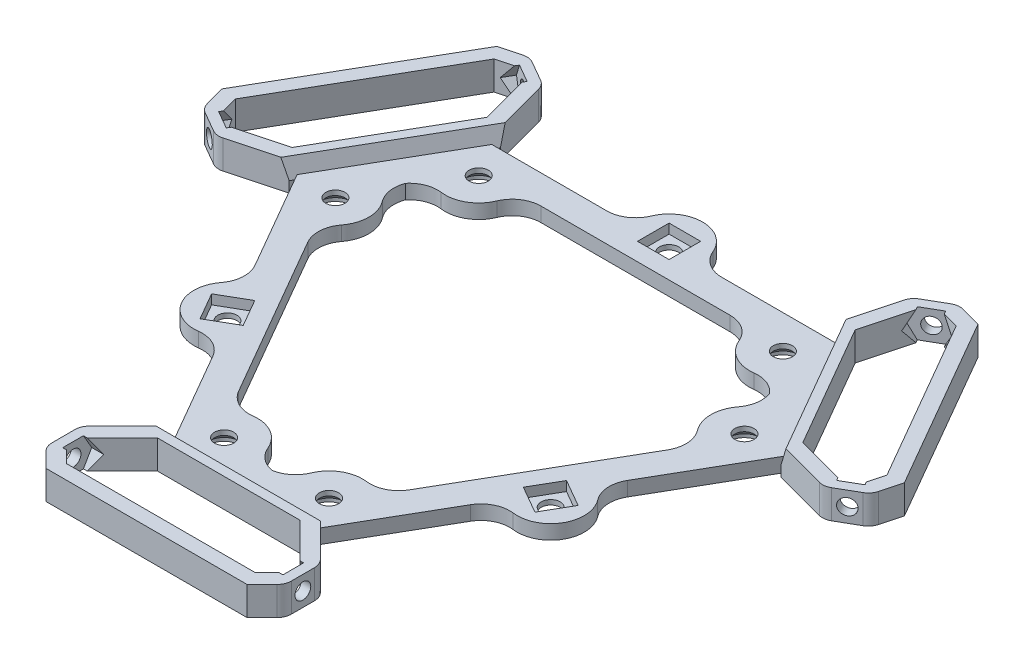
from build123d import *

# Parameters (mm, degrees)
BOSS_EXTRUDE1_DEPTH     = 3
BOSS_EXTRUDE2_DEPTH     = 6
SKETCH3_R               = 1.65
CUT_EXTRUDE1_DEPTH      = 104.454603872
CUT_EXTRUDE2_DEPTH      = 45.757359
CUT_EXTRUDE2_DEPTH_BACK = 0.242641
CIRPATTERN2_COUNT       = 3
CUT_EXTRUDE4_DEPTH      = 45.757359
CUT_EXTRUDE4_DEPTH_BACK = 0.242641
CUT_EXTRUDE5_DEPTH      = 45.757359
CUT_EXTRUDE5_DEPTH_BACK = 0.242641
SKETCH5_R               = 2
CUT_EXTRUDE3_DEPTH      = 101.034117673
CHAMFER1_SIZE           = 3.732050808
CHAMFER1_SIZE_2         = 1
FILLET2_R               = 3
SKETCH8_R               = 3.3
CUT_EXTRUDE6_DEPTH      = 2
CHAMFER2_SIZE           = 1.3
SKETCH9_R               = 7
BOSS_EXTRUDE3_DEPTH     = 3
SKETCH10_W              = 6.6
SKETCH10_H              = 6.6
CUT_EXTRUDE7_DEPTH      = 2
SKETCH11_R              = 2
CUT_EXTRUDE8_DEPTH      = 101.034117673
FILLET1_R               = 6


# Some blends are built 0.0001 mm under size
with BuildPart() as part:
    # Sketch1 → Boss-Extrude1 (new body)
    with BuildSketch(Plane(origin=(0, 0, 0), x_dir=(1, 0, 0), z_dir=(0, 1, 0))):
        Polygon((50.801270189, 12.009618943), (35.801270189, 37.990381057), (-35.801270189, 37.990381057), (-50.801270189, 12.009618943), (-15, -50), (15, -50), align=None)
        with BuildLine():
            Line((-40.120290209, 18.509618943), (-36.089945324, 25.490381057))
            ThreePointArc((-36.089945324, 25.490381057), (-28.259818305, 24.92820323), (-24.831615075, 31.990381057))
            Line((-24.831615075, 31.990381057), (24.831615075, 31.990381057))
            ThreePointArc((24.831615075, 31.990381057), (28.259818305, 24.92820323), (36.089945324, 25.490381057))
            Line((36.089945324, 25.490381057), (40.120290209, 18.509618943))
            ThreePointArc((40.120290209, 18.509618943), (35.718366421, 12.009618943), (40.120290209, 5.509618943))
            Line((40.120290209, 5.509618943), (15.288675135, -37.5))
            ThreePointArc((15.288675135, -37.5), (7.458548116, -36.937822174), (4.030344885, -44))
            Line((4.030344885, -44), (-4.030344885, -44))
            ThreePointArc((-4.030344885, -44), (-7.458548116, -36.937822174), (-15.288675135, -37.5))
            Line((-15.288675135, -37.5), (-40.120290209, 5.509618943))
            ThreePointArc((-40.120290209, 5.509618943), (-35.718366421, 12.009618943), (-40.120290209, 18.509618943))
        make_face(mode=Mode.SUBTRACT)
    extrude(amount=BOSS_EXTRUDE1_DEPTH)

    # Sketch2 → Boss-Extrude2 (add)
    with BuildSketch(Plane.XZ):
        Polygon((25, 60.85), (25, 58.85), (16.15, 50), (-16.15, 50), (-25, 58.85), (-25, 60.85), (-25, 64.15), (-25, 66.15), (-21, 70.15), (21, 70.15), (25, 66.15), (25, 64.15), align=None)
        Polygon((-14.907359313, 53), (14.907359313, 53), (22.757359313, 60.85), (22.757359313, 64.15), (19.757359313, 67.15), (-19.757359313, 67.15), (-22.757359313, 64.15), (-22.757359313, 60.85), align=None, mode=Mode.SUBTRACT)
    boss_extrude2 = extrude(amount=-BOSS_EXTRUDE2_DEPTH)

    # Sketch3 → Cut-Extrude1 (cut, through all)
    with BuildSketch(Plane(origin=(25, 0, 0), x_dir=(0, 0, -1), z_dir=(1, 0, 0))):
        with Locations(Location((-62.5, 3, 0), (0, 0, 180))):
            Circle(SKETCH3_R)
    cut_extrude1 = extrude(amount=-CUT_EXTRUDE1_DEPTH, mode=Mode.SUBTRACT)

    # Sketch4 → Cut-Extrude2 (cut, two sides: drawn at the far end of the back side and taken through both)
    with BuildSketch(Plane(origin=(-22.757359313, 0, 0), x_dir=(0, 0, -1), z_dir=(1, 0, 0)).offset(-CUT_EXTRUDE2_DEPTH_BACK)):
        Polygon((-58.602885683, 3), (-60.551442841, 6.375), (-64.448557159, 6.375), (-66.397114317, 3), (-64.448557159, -0.375), (-60.551442841, -0.375), align=None)
    extrude(amount=CUT_EXTRUDE2_DEPTH + CUT_EXTRUDE2_DEPTH_BACK, mode=Mode.SUBTRACT)

    # CirPattern2: Boss-Extrude2, Cut-Extrude1 ×3 about axis
    cirpattern2_axis = Axis((0, 0, 0), (0, 1, 0))
    add([boss_extrude2.rotate(cirpattern2_axis, i * 360 / CIRPATTERN2_COUNT) for i in range(1, CIRPATTERN2_COUNT)])
    add([cut_extrude1.rotate(cirpattern2_axis, i * 360 / CIRPATTERN2_COUNT) for i in range(1, CIRPATTERN2_COUNT)], mode=Mode.SUBTRACT)

    # Sketch6 → Cut-Extrude4 (cut, two sides: drawn at the far end of the back side and taken through both)
    with BuildSketch(Plane(origin=(-11.378679656, 0, -19.708451288), x_dir=(0.8660254037844433, 0, -0.4999999999999921), z_dir=(0.49999999999999206, 0, 0.8660254037844431)).offset(-CUT_EXTRUDE4_DEPTH_BACK)):
        Polygon((58.602885683, 3), (60.551442841, -0.375), (64.448557159, -0.375), (66.397114317, 3), (64.448557159, 6.375), (60.551442841, 6.375), align=None)
    extrude(amount=CUT_EXTRUDE4_DEPTH + CUT_EXTRUDE4_DEPTH_BACK, mode=Mode.SUBTRACT)

    # Sketch7 → Cut-Extrude5 (cut, two sides: drawn at the far end of the back side and taken through both)
    with BuildSketch(Plane(origin=(-11.378679656, 0, 19.708451288), x_dir=(-0.8660254037844364, 0, -0.500000000000004), z_dir=(0.500000000000004, 0, -0.8660254037844365)).offset(-CUT_EXTRUDE5_DEPTH_BACK)):
        Polygon((58.602885683, 3), (60.551442841, -0.375), (64.448557159, -0.375), (66.397114317, 3), (64.448557159, 6.375), (60.551442841, 6.375), align=None)
    extrude(amount=CUT_EXTRUDE5_DEPTH + CUT_EXTRUDE5_DEPTH_BACK, mode=Mode.SUBTRACT)

    # Sketch5 → Cut-Extrude3 (cut, through all)
    with BuildSketch(Plane(origin=(0, 3, 0), x_dir=(1, 0, 0), z_dir=(0, 1, 0))):
        with Locations(Location((42.718366421, 12.009618943, 0), (0, 0, 270))):
            Circle(SKETCH5_R)
        with Locations(Location((31.759818305, 30.990381057, 0), (0, 0, 270))):
            Circle(SKETCH5_R)
        with Locations(Location((10.958548116, -43, 0), (0, 0, 270))):
            Circle(SKETCH5_R)
        with Locations(Location((-10.958548116, -43, 0), (0, 0, 270))):
            Circle(SKETCH5_R)
        with Locations(Location((-42.718366421, 12.009618943, 0), (0, 0, 270))):
            Circle(SKETCH5_R)
        with Locations(Location((-31.759818305, 30.990381057, 0), (0, 0, 270))):
            Circle(SKETCH5_R)
    extrude(amount=-CUT_EXTRUDE3_DEPTH, mode=Mode.SUBTRACT)

    # Chamfer1
    # the kernel refuses this chamfer: 3.732050808, 1 mm, written as the material it takes off along each edge
    with BuildSketch(Plane(origin=(30.380721773, 6, -47.379046319), x_dir=(-0.00863180213905993, -0.9999503267608393, 0.004983573288577835), z_dir=(0.49999999999999983, 0, 0.8660254037844388))) as chamfer1_piece_1_section:
        Polygon((CHAMFER1_SIZE * 0.999950326645, CHAMFER1_SIZE * 0.009967146576), (-CHAMFER1_SIZE_2 * 0.00996714657716, CHAMFER1_SIZE_2 * 0.999950326761), (0, 0), align=None)
    chamfer1_piece_1 = extrude(amount=51.682193666, mode=Mode.PRIVATE)
    chamfer1_piece_1 = split(chamfer1_piece_1, bisect_by=Plane(origin=(33.0925321, 2.648418208, -37.990381057), z_dir=(0, 0, -1)), keep=Keep.TOP, mode=Mode.PRIVATE)
    chamfer1_piece_1 = split(chamfer1_piece_1, bisect_by=Plane(origin=(33.0925321, 3, -42.685093779), z_dir=(0, -1, 0)), keep=Keep.TOP, mode=Mode.PRIVATE)
    add(chamfer1_piece_1, mode=Mode.SUBTRACT)
    with BuildSketch(Plane(origin=(30.380721773, 6, -47.379046319), x_dir=(-0.00863180213905993, -0.9999503267608393, 0.004983573288577835), z_dir=(0.49999999999999983, 0, 0.8660254037844388))) as chamfer1_piece_2_section:
        Polygon((CHAMFER1_SIZE * 0.999950326645, CHAMFER1_SIZE * 0.009967146576), (-CHAMFER1_SIZE_2 * 0.00996714657716, CHAMFER1_SIZE_2 * 0.999950326761), (0, 0), align=None)
    chamfer1_piece_2 = extrude(amount=51.682193666, mode=Mode.PRIVATE)
    chamfer1_piece_2 = split(chamfer1_piece_2, bisect_by=Plane(origin=(33.414534545, 4.859018741, -37.990381057), z_dir=(0, 0, -1)), keep=Keep.TOP, mode=Mode.PRIVATE)
    chamfer1_piece_2 = split(chamfer1_piece_2, bisect_by=Plane(origin=(33.414534545, 3, -42.764768721), z_dir=(0, 1, 0)), keep=Keep.TOP, mode=Mode.PRIVATE)
    add(chamfer1_piece_2, mode=Mode.SUBTRACT)
    with BuildSketch(Plane(origin=(30.380721773, 6, -47.379046319), x_dir=(-0.00863180213905993, -0.9999503267608393, 0.004983573288577835), z_dir=(0.49999999999999983, 0, 0.8660254037844388))) as chamfer1_piece_3_section:
        Polygon((CHAMFER1_SIZE * 0.999950326645, CHAMFER1_SIZE * 0.009967146576), (-CHAMFER1_SIZE_2 * 0.00996714657716, CHAMFER1_SIZE_2 * 0.999950326761), (0, 0), align=None)
    chamfer1_piece_3 = extrude(amount=51.682193666, mode=Mode.PRIVATE)
    chamfer1_piece_3 = split(chamfer1_piece_3, bisect_by=Plane(origin=(43.573101268, 4.849417348, -37.990381057), z_dir=(0, 0, 1)), keep=Keep.TOP, mode=Mode.PRIVATE)
    chamfer1_piece_3 = split(chamfer1_piece_3, bisect_by=Plane(origin=(43.573101268, 3, -25.156941746), z_dir=(0, 1, 0)), keep=Keep.TOP, mode=Mode.PRIVATE)
    chamfer1_piece_3 = split(chamfer1_piece_3, bisect_by=Plane(origin=(54.687185728, 4.849417348, -18.740222091), z_dir=(-0.8660254037844388, 0, -0.4999999999999998)), keep=Keep.TOP, mode=Mode.PRIVATE)
    add(chamfer1_piece_3, mode=Mode.SUBTRACT)
    with BuildSketch(Plane(origin=(30.380721773, 6, -47.379046319), x_dir=(-0.00863180213905993, -0.9999503267608393, 0.004983573288577835), z_dir=(0.49999999999999983, 0, 0.8660254037844388))) as chamfer1_piece_4_section:
        Polygon((CHAMFER1_SIZE * 0.999950326645, CHAMFER1_SIZE * 0.009967146576), (-CHAMFER1_SIZE_2 * 0.00996714657716, CHAMFER1_SIZE_2 * 0.999950326761), (0, 0), align=None)
    chamfer1_piece_4 = extrude(amount=51.682193666, mode=Mode.PRIVATE)
    chamfer1_piece_4 = split(chamfer1_piece_4, bisect_by=Plane(origin=(53.512641626, 3, -7.316426585), z_dir=(0, -1, 0)), keep=Keep.TOP, mode=Mode.PRIVATE)
    chamfer1_piece_4 = split(chamfer1_piece_4, bisect_by=Plane(origin=(49.446901145, 2.648418208, -9.663782946), z_dir=(0.8660254037844388, 0, 0.4999999999999998)), keep=Keep.TOP, mode=Mode.PRIVATE)
    add(chamfer1_piece_4, mode=Mode.SUBTRACT)
    with BuildSketch(Plane(origin=(30.380721773, 6, -47.379046319), x_dir=(-0.00863180213905993, -0.9999503267608393, 0.004983573288577835), z_dir=(0.49999999999999983, 0, 0.8660254037844388))) as chamfer1_piece_5_section:
        Polygon((CHAMFER1_SIZE * 0.999950326645, CHAMFER1_SIZE * 0.009967146576), (-CHAMFER1_SIZE_2 * 0.00996714657716, CHAMFER1_SIZE_2 * 0.999950326761), (0, 0), align=None)
    chamfer1_piece_5 = extrude(amount=51.682193666, mode=Mode.PRIVATE)
    chamfer1_piece_5 = split(chamfer1_piece_5, bisect_by=Plane(origin=(53.742643372, 3, -7.555451411), z_dir=(0, 1, 0)), keep=Keep.TOP, mode=Mode.PRIVATE)
    chamfer1_piece_5 = split(chamfer1_piece_5, bisect_by=Plane(origin=(49.607902367, 4.859018741, -9.942645243), z_dir=(0.8660254037844388, 0, 0.4999999999999998)), keep=Keep.TOP, mode=Mode.PRIVATE)
    add(chamfer1_piece_5, mode=Mode.SUBTRACT)
    with BuildSketch(Plane(origin=(25.841096833, 6, 50), x_dir=(0, -0.9999503267608393, -0.00996714657715677), z_dir=(-1, 0, 0))) as chamfer1_piece_6_section:
        Polygon((CHAMFER1_SIZE * 0.999950326645, CHAMFER1_SIZE * 0.00996714657601), (-CHAMFER1_SIZE_2 * 0.00996714657716, CHAMFER1_SIZE_2 * 0.999950326761), (0, 0), align=None)
    chamfer1_piece_6 = extrude(amount=51.682193666, mode=Mode.PRIVATE)
    chamfer1_piece_6 = split(chamfer1_piece_6, bisect_by=Plane(origin=(16.354369044, 2.648418208, 47.654164003), z_dir=(0.8660254037844388, 0, 0.4999999999999998)), keep=Keep.TOP, mode=Mode.PRIVATE)
    chamfer1_piece_6 = split(chamfer1_piece_6, bisect_by=Plane(origin=(20.420109525, 3, 50.001520364), z_dir=(0, -1, 0)), keep=Keep.TOP, mode=Mode.PRIVATE)
    add(chamfer1_piece_6, mode=Mode.SUBTRACT)
    with BuildSketch(Plane(origin=(25.841096833, 6, 50), x_dir=(0, -0.9999503267608393, -0.00996714657715677), z_dir=(-1, 0, 0))) as chamfer1_piece_7_section:
        Polygon((CHAMFER1_SIZE * 0.999950326645, CHAMFER1_SIZE * 0.00996714657601), (-CHAMFER1_SIZE_2 * 0.00996714657716, CHAMFER1_SIZE_2 * 0.999950326761), (0, 0), align=None)
    chamfer1_piece_7 = extrude(amount=51.682193666, mode=Mode.PRIVATE)
    chamfer1_piece_7 = split(chamfer1_piece_7, bisect_by=Plane(origin=(16.193367822, 4.859018741, 47.9330263), z_dir=(0.8660254037844388, 0, 0.4999999999999998)), keep=Keep.TOP, mode=Mode.PRIVATE)
    chamfer1_piece_7 = split(chamfer1_piece_7, bisect_by=Plane(origin=(20.328108827, 3, 50.320220132), z_dir=(0, 1, 0)), keep=Keep.TOP, mode=Mode.PRIVATE)
    add(chamfer1_piece_7, mode=Mode.SUBTRACT)
    with BuildSketch(Plane(origin=(25.841096833, 6, 50), x_dir=(0, -0.9999503267608393, -0.00996714657715677), z_dir=(-1, 0, 0))) as chamfer1_piece_8_section:
        Polygon((CHAMFER1_SIZE * 0.999950326645, CHAMFER1_SIZE * 0.00996714657601), (-CHAMFER1_SIZE_2 * 0.00996714657716, CHAMFER1_SIZE_2 * 0.999950326761), (0, 0), align=None)
    chamfer1_piece_8 = extrude(amount=51.682193666, mode=Mode.PRIVATE)
    chamfer1_piece_8 = split(chamfer1_piece_8, bisect_by=Plane(origin=(-11.114084461, 4.849417348, 56.730603148), z_dir=(0.866025403784439, 0, -0.49999999999999944)), keep=Keep.TOP, mode=Mode.PRIVATE)
    chamfer1_piece_8 = split(chamfer1_piece_8, bisect_by=Plane(origin=(11.114084461, 4.849417348, 56.730603148), z_dir=(-0.8660254037844388, 0, -0.4999999999999998)), keep=Keep.TOP, mode=Mode.PRIVATE)
    chamfer1_piece_8 = split(chamfer1_piece_8, bisect_by=Plane(origin=(0, 3, 50.313883493), z_dir=(0, 1, 0)), keep=Keep.TOP, mode=Mode.PRIVATE)
    add(chamfer1_piece_8, mode=Mode.SUBTRACT)
    with BuildSketch(Plane(origin=(25.841096833, 6, 50), x_dir=(0, -0.9999503267608393, -0.00996714657715677), z_dir=(-1, 0, 0))) as chamfer1_piece_9_section:
        Polygon((CHAMFER1_SIZE * 0.999950326645, CHAMFER1_SIZE * 0.00996714657601), (-CHAMFER1_SIZE_2 * 0.00996714657716, CHAMFER1_SIZE_2 * 0.999950326761), (0, 0), align=None)
    chamfer1_piece_9 = extrude(amount=51.682193666, mode=Mode.PRIVATE)
    chamfer1_piece_9 = split(chamfer1_piece_9, bisect_by=Plane(origin=(-16.354369044, 2.648418208, 47.654164003), z_dir=(-0.866025403784439, 0, 0.49999999999999944)), keep=Keep.TOP, mode=Mode.PRIVATE)
    chamfer1_piece_9 = split(chamfer1_piece_9, bisect_by=Plane(origin=(-20.420109525, 3, 50.001520364), z_dir=(0, -1, 0)), keep=Keep.TOP, mode=Mode.PRIVATE)
    add(chamfer1_piece_9, mode=Mode.SUBTRACT)
    with BuildSketch(Plane(origin=(25.841096833, 6, 50), x_dir=(0, -0.9999503267608393, -0.00996714657715677), z_dir=(-1, 0, 0))) as chamfer1_piece_10_section:
        Polygon((CHAMFER1_SIZE * 0.999950326645, CHAMFER1_SIZE * 0.00996714657601), (-CHAMFER1_SIZE_2 * 0.00996714657716, CHAMFER1_SIZE_2 * 0.999950326761), (0, 0), align=None)
    chamfer1_piece_10 = extrude(amount=51.682193666, mode=Mode.PRIVATE)
    chamfer1_piece_10 = split(chamfer1_piece_10, bisect_by=Plane(origin=(-16.193367822, 4.859018741, 47.9330263), z_dir=(-0.866025403784439, 0, 0.49999999999999944)), keep=Keep.TOP, mode=Mode.PRIVATE)
    chamfer1_piece_10 = split(chamfer1_piece_10, bisect_by=Plane(origin=(-20.328108827, 3, 50.320220132), z_dir=(0, 1, 0)), keep=Keep.TOP, mode=Mode.PRIVATE)
    add(chamfer1_piece_10, mode=Mode.SUBTRACT)
    with BuildSketch(Plane(origin=(-56.221818606, 6, -2.620953681), x_dir=(-0.8577981960727488, 0.1375124470212913, -0.49525001941297747), z_dir=(0.5000000000000004, 0, -0.8660254037844384))) as chamfer1_piece_11_section:
        Polygon((CHAMFER1_SIZE_2 * 0.990500038826, -CHAMFER1_SIZE_2 * 0.137512447021), (-CHAMFER1_SIZE * 0.137512447005, -CHAMFER1_SIZE * 0.990500038712), (0, 0), align=None)
    chamfer1_piece_11 = extrude(amount=51.682193666, mode=Mode.PRIVATE)
    chamfer1_piece_11 = split(chamfer1_piece_11, bisect_by=Plane(origin=(-49.607902367, 4.859018741, -9.942645243), z_dir=(-0.866025403784439, 0, 0.49999999999999944)), keep=Keep.TOP, mode=Mode.PRIVATE)
    chamfer1_piece_11 = split(chamfer1_piece_11, bisect_by=Plane(origin=(-53.742643372, 3, -7.555451411), z_dir=(0, 1, 0)), keep=Keep.TOP, mode=Mode.PRIVATE)
    add(chamfer1_piece_11, mode=Mode.SUBTRACT)
    with BuildSketch(Plane(origin=(-56.221818606, 6, -2.620953681), x_dir=(-0.8577981960727488, 0.1375124470212913, -0.49525001941297747), z_dir=(0.5000000000000004, 0, -0.8660254037844384))) as chamfer1_piece_12_section:
        Polygon((CHAMFER1_SIZE_2 * 0.990500038826, -CHAMFER1_SIZE_2 * 0.137512447021), (-CHAMFER1_SIZE * 0.137512447005, -CHAMFER1_SIZE * 0.990500038712), (0, 0), align=None)
    chamfer1_piece_12 = extrude(amount=51.682193666, mode=Mode.PRIVATE)
    chamfer1_piece_12 = split(chamfer1_piece_12, bisect_by=Plane(origin=(-49.446901145, 2.648418208, -9.663782946), z_dir=(-0.866025403784439, 0, 0.49999999999999944)), keep=Keep.TOP, mode=Mode.PRIVATE)
    chamfer1_piece_12 = split(chamfer1_piece_12, bisect_by=Plane(origin=(-53.512641626, 3, -7.316426585), z_dir=(0, -1, 0)), keep=Keep.TOP, mode=Mode.PRIVATE)
    add(chamfer1_piece_12, mode=Mode.SUBTRACT)
    with BuildSketch(Plane(origin=(-56.221818606, 6, -2.620953681), x_dir=(-0.8577981960727488, 0.1375124470212913, -0.49525001941297747), z_dir=(0.5000000000000004, 0, -0.8660254037844384))) as chamfer1_piece_13_section:
        Polygon((CHAMFER1_SIZE_2 * 0.990500038826, -CHAMFER1_SIZE_2 * 0.137512447021), (-CHAMFER1_SIZE * 0.137512447005, -CHAMFER1_SIZE * 0.990500038712), (0, 0), align=None)
    chamfer1_piece_13 = extrude(amount=51.682193666, mode=Mode.PRIVATE)
    chamfer1_piece_13 = split(chamfer1_piece_13, bisect_by=Plane(origin=(-54.687185728, 4.849417348, -18.740222091), z_dir=(0.866025403784439, 0, -0.49999999999999944)), keep=Keep.TOP, mode=Mode.PRIVATE)
    chamfer1_piece_13 = split(chamfer1_piece_13, bisect_by=Plane(origin=(-43.573101268, 3, -25.156941746), z_dir=(0, 1, 0)), keep=Keep.TOP, mode=Mode.PRIVATE)
    chamfer1_piece_13 = split(chamfer1_piece_13, bisect_by=Plane(origin=(-43.573101268, 4.849417348, -37.990381057), z_dir=(0, 0, 1)), keep=Keep.TOP, mode=Mode.PRIVATE)
    add(chamfer1_piece_13, mode=Mode.SUBTRACT)
    with BuildSketch(Plane(origin=(-56.221818606, 6, -2.620953681), x_dir=(-0.8577981960727488, 0.1375124470212913, -0.49525001941297747), z_dir=(0.5000000000000004, 0, -0.8660254037844384))) as chamfer1_piece_14_section:
        Polygon((CHAMFER1_SIZE_2 * 0.990500038826, -CHAMFER1_SIZE_2 * 0.137512447021), (-CHAMFER1_SIZE * 0.137512447005, -CHAMFER1_SIZE * 0.990500038712), (0, 0), align=None)
    chamfer1_piece_14 = extrude(amount=51.682193666, mode=Mode.PRIVATE)
    chamfer1_piece_14 = split(chamfer1_piece_14, bisect_by=Plane(origin=(-33.414534545, 3, -42.764768721), z_dir=(0, 1, 0)), keep=Keep.TOP, mode=Mode.PRIVATE)
    chamfer1_piece_14 = split(chamfer1_piece_14, bisect_by=Plane(origin=(-33.414534545, 4.859018741, -37.990381057), z_dir=(0, 0, -1)), keep=Keep.TOP, mode=Mode.PRIVATE)
    add(chamfer1_piece_14, mode=Mode.SUBTRACT)
    with BuildSketch(Plane(origin=(-56.221818606, 6, -2.620953681), x_dir=(-0.8577981960727488, 0.1375124470212913, -0.49525001941297747), z_dir=(0.5000000000000004, 0, -0.8660254037844384))) as chamfer1_piece_15_section:
        Polygon((CHAMFER1_SIZE_2 * 0.990500038826, -CHAMFER1_SIZE_2 * 0.137512447021), (-CHAMFER1_SIZE * 0.137512447005, -CHAMFER1_SIZE * 0.990500038712), (0, 0), align=None)
    chamfer1_piece_15 = extrude(amount=51.682193666, mode=Mode.PRIVATE)
    chamfer1_piece_15 = split(chamfer1_piece_15, bisect_by=Plane(origin=(-33.0925321, 3, -42.685093779), z_dir=(0, -1, 0)), keep=Keep.TOP, mode=Mode.PRIVATE)
    chamfer1_piece_15 = split(chamfer1_piece_15, bisect_by=Plane(origin=(-33.0925321, 2.648418208, -37.990381057), z_dir=(0, 0, -1)), keep=Keep.TOP, mode=Mode.PRIVATE)
    add(chamfer1_piece_15, mode=Mode.SUBTRACT)

    # Fillet2
    fillet2_edges = [part.edges().sort_by_distance(p)[0] for p in [
        (-69.78758046, 3, -11.424364905),
        (-63.465595013, 3, -7.774364905),
        (-38.465595013, 3, -51.075635095),
        (-44.78758046, 3, -54.725635095),
        (44.78758046, 3, -54.725635095),
        (38.465595013, 3, -51.075635095),
        (63.465595013, 3, -7.774364905),
        (69.78758046, 3, -11.424364905),
        (25, 3, 66.15),
        (25, 3, 58.85),
        (-25, 3, 58.85),
        (-25, 3, 66.15),
    ]]
    fillet(fillet2_edges, radius=FILLET2_R)

    # Sketch8 → Cut-Extrude6 (cut)
    with BuildSketch(Plane.XZ):
        with Locations(Location((31.759818305, -30.990381057, 0), (0, 0, 270))):
            Circle(SKETCH8_R)
        with Locations(Location((42.718366421, -12.009618943, 0), (0, 0, 270))):
            Circle(SKETCH8_R)
        with Locations(Location((10.958548116, 43, 0), (0, 0, 270))):
            Circle(SKETCH8_R)
        with Locations(Location((-10.958548116, 43, 0), (0, 0, 270))):
            Circle(SKETCH8_R)
        with Locations(Location((-42.718366421, -12.009618943, 0), (0, 0, 270))):
            Circle(SKETCH8_R)
        with Locations(Location((-31.759818305, -30.990381057, 0), (0, 0, 270))):
            Circle(SKETCH8_R)
    extrude(amount=-CUT_EXTRUDE6_DEPTH, mode=Mode.SUBTRACT)

    # Chamfer2
    chamfer2_edges = [part.edges().sort_by_distance(p)[0] for p in [
        (31.759818305, 2, -27.690381057),
        (42.718366421, 2, -8.709618943),
        (10.958548116, 2, 46.3),
        (-10.958548116, 2, 46.3),
        (-42.718366421, 2, -8.709618943),
        (-31.759818305, 2, -27.690381057),
    ]]
    chamfer(chamfer2_edges, length=CHAMFER2_SIZE - 0.0001)  # a hair under: the kernel refuses the full size

    # Sketch9 → Boss-Extrude3 (add)
    with BuildSketch(Plane.XZ):
        with Locations((-33.766660498, 19.495190528)):
            Circle(SKETCH9_R)
        with Locations((33.766660498, 19.495190528)):
            Circle(SKETCH9_R)
        with Locations((0, -38.990381057)):
            Circle(SKETCH9_R)
    extrude(amount=-BOSS_EXTRUDE3_DEPTH)

    # Sketch10 → Cut-Extrude7 (cut)
    with BuildSketch(Plane(origin=(0, 3, 0), x_dir=(1, 0, 0), z_dir=(0, 1, 0))):
        Polygon((32.558776666, -14.987306696), (29.258776666, -20.703074361), (34.974544331, -24.003074361), (38.274544331, -18.287306696), align=None)
        with Locations((0, 38.990381057)):
            Rectangle(SKETCH10_W, SKETCH10_H)
        Polygon((-29.258776666, -20.703074361), (-32.558776666, -14.987306696), (-38.274544331, -18.287306696), (-34.974544331, -24.003074361), align=None)
    extrude(amount=-CUT_EXTRUDE7_DEPTH, mode=Mode.SUBTRACT)

    # Sketch11 → Cut-Extrude8 (cut, through all)
    with BuildSketch(Plane(origin=(0, 3, 0), x_dir=(1, 0, 0), z_dir=(0, 1, 0))):
        with Locations(Location((-33.766660498, -19.495190528, 0), (0, 0, 270))):
            Circle(SKETCH11_R)
        with Locations(Location((33.766660498, -19.495190528, 0), (0, 0, 270))):
            Circle(SKETCH11_R)
        with Locations(Location((0, 38.990381057, 0), (0, 0, 270))):
            Circle(SKETCH11_R)
    extrude(amount=-CUT_EXTRUDE8_DEPTH, mode=Mode.SUBTRACT)

    # Fillet1
    # the kernel refuses this fillet: 6 mm, written as the material it adds along each edge
    with BuildSketch(Plane(origin=(-40.120290209, 0, -18.509618943), x_dir=(0.7964948080619212, 0, 0.6046453677407967), z_dir=(0, 1, 0)), Plane(origin=(36.089945324, 0, -25.490381057), x_dir=(-0.9218856527750745, 0, 0.38746205389363575), z_dir=(0, 1, 0)), Plane(origin=(-24.831615075, 0, -31.990381057), x_dir=(-0.12539084471315703, 0, 0.9921074216344322), z_dir=(0, 1, 0)), Plane(origin=(-36.36473671, 3, 12.995190528), x_dir=(-0.7964948080619212, 0, 0.6046453677407967), z_dir=(0, -1, 0))) as fillet1_piece_1:
        with BuildLine():
            CenterArc((5.316687649, 5.784112285), FILLET1_R, 187.203327123, 67.380135052)
            Line((-0.635956881, 5.031767216), (0, 0))
            ThreePointArc((0, 0), (1.860840677, 0.251869001), (3.721681354, 0))
        make_face()
    extrude(amount=3)
    with BuildSketch(Plane(origin=(-15.288675135, 0, 37.5), x_dir=(-0.5000000000000007, 0, -0.8660254037844382), z_dir=(0, 1, 0)), Plane(origin=(4.030344885, 0, 44), x_dir=(-1, 0, 0), z_dir=(0, 1, 0)), Plane(origin=(40.120290209, 0, -5.509618943), x_dir=(-0.4999999999999995, 0, 0.8660254037844389), z_dir=(0, 1, 0)), Plane(origin=(29.436533479, 3, 24.995190528), x_dir=(-0.4999999999999999, 0, 0.8660254037844387), z_dir=(0, -1, 0)), Plane(origin=(6.92820323, 3, -37.990381057), x_dir=(1, 0, 0), z_dir=(0, -1, 0))) as fillet1_piece_2:
        with BuildLine():
            CenterArc((5.07179677, -6), FILLET1_R, 90, 67.380135052)
            ThreePointArc((-0.466664769, -3.692307692), (0.016548721, -1.877735913), (0, 0))
            Line((0, 0), (5.07179677, 0))
        make_face()
    extrude(amount=3)
    with BuildSketch(Plane(origin=(-4.030344885, 0, 44), x_dir=(-0.12539084471315537, 0, -0.9921074216344323), z_dir=(0, 1, 0)), Plane(origin=(15.288675135, 0, 37.5), x_dir=(-0.921885652775076, 0, -0.3874620538936326), z_dir=(0, 1, 0)), Plane(origin=(40.120290209, 0, -18.509618943), x_dir=(-0.7964948080619191, 0, 0.6046453677407995), z_dir=(0, 1, 0)), Plane(origin=(36.36473671, 3, 12.995190528), x_dir=(0.7964948080619222, 0, 0.6046453677407955), z_dir=(0, -1, 0)), Plane(origin=(-6.92820323, 3, -37.990381057), x_dir=(0.1253908447131521, 0, -0.9921074216344328), z_dir=(0, -1, 0))) as fillet1_piece_3:
        with BuildLine():
            CenterArc((5.316687649, -5.784112285), FILLET1_R, 105.416537825, 67.380135052)
            Line((-0.635956881, -5.031767216), (0, 0))
            ThreePointArc((0, 0), (1.860840677, -0.251869001), (3.721681354, 0))
        make_face()
    extrude(amount=3)
    with BuildSketch(Plane(origin=(24.831615075, 0, -31.990381057), x_dir=(-1, 0, 0), z_dir=(0, 1, 0)), Plane(origin=(-36.089945324, 0, -25.490381057), x_dir=(-0.49999999999999967, 0, 0.8660254037844389), z_dir=(0, 1, 0)), Plane(origin=(-40.120290209, 0, -5.509618943), x_dir=(0.5000000000000014, 0, 0.8660254037844378), z_dir=(0, 1, 0)), Plane(origin=(-29.436533479, 3, 24.995190528), x_dir=(0.4999999999999993, 0, 0.866025403784439), z_dir=(0, -1, 0))) as fillet1_piece_4:
        with BuildLine():
            CenterArc((5.07179677, 6), FILLET1_R, 202.619864948, 67.380135052)
            ThreePointArc((-0.466664769, 3.692307692), (0.016548721, 1.877735913), (0, 0))
            Line((0, 0), (5.07179677, 0))
        make_face()
    extrude(amount=3)


solid = part.part
